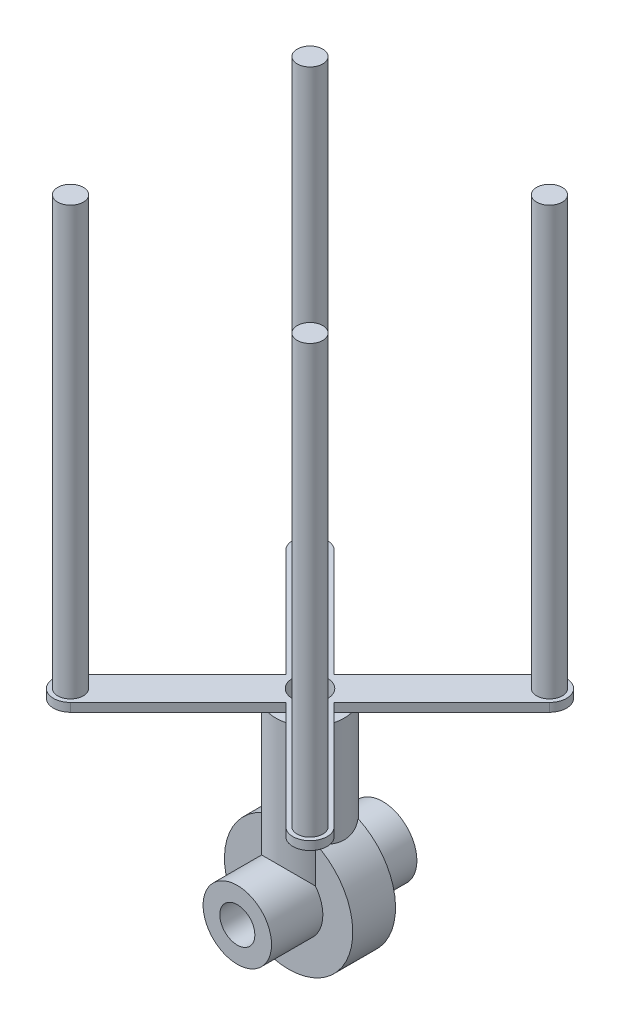
from build123d import *
from build123d.topology import SkipClean

# Parameters (mm, degrees)
SKETCH1_R           = 7.5000000000000115
SKETCH1_R_2         = 2.0499999999999923
BOSS_EXTRUDE1_DEPTH = 2.5
SKETCH2_R           = 4.000000000000007
SKETCH2_R_2         = 2.0499999999999923
BOSS_EXTRUDE2_DEPTH = 6
SKETCH7_W           = 4
SKETCH7_H           = 18.68716473083859
REVOLVE7_ANGLE      = 180.0000000000004
SKETCH8_W           = 2.049999999999997
SKETCH8_H           = 18.68716473083859
SKETCH9_R           = 2.0499999999999923
CUT_EXTRUDE1_DEPTH  = 5
BOSS_EXTRUDE3_START = 1
SKETCH10_R          = 2.049999999999978
BOSS_EXTRUDE3_DEPTH = 1
SKETCH11_R          = 1.4999999999999973
SKETCH11_R_2        = 1.4999999999999951
SKETCH11_R_3        = 1.4999999999999936
BOSS_EXTRUDE4_DEPTH = 50


with BuildPart() as part:
    # Sketch1 → Boss-Extrude1 (new body)
    with BuildSketch(Plane.XY):
        with Locations((102.34120530056146, 36.41611338878192)):
            Circle(SKETCH1_R)
        with Locations((102.34120530056146, 36.41611338878192)):
            Circle(SKETCH1_R_2, mode=Mode.SUBTRACT)
    boss_extrude1 = extrude(amount=BOSS_EXTRUDE1_DEPTH)

    # Sketch2 → Boss-Extrude2 (add)
    with BuildSketch(Plane.XY.offset(2.5)):
        with Locations((102.34120530056146, 36.41611338878192)):
            Circle(SKETCH2_R)
        with Locations((102.34120530056146, 36.41611338878192)):
            Circle(SKETCH2_R_2, mode=Mode.SUBTRACT)
    boss_extrude2 = extrude(amount=BOSS_EXTRUDE2_DEPTH)

    # Sketch7 → Revolve7 (revolve)
    with BuildSketch(Plane(origin=(0, 0, 0), x_dir=(-1, 0, 0), z_dir=(0, 0, -1))):
        with Locations((-104.34120530056146, 45.75969575420122)):
            Rectangle(SKETCH7_W, SKETCH7_H)
    revolve7 = revolve(axis=Axis((102.34120530056146, 36.41611338878192, 0), (0, -1, 0)), revolution_arc=REVOLVE7_ANGLE)

    # Sketch8 → Cut-Revolve2 (revolve, cut)
    with BuildSketch(Plane(origin=(0, 0, 0), x_dir=(-1, 0, 0), z_dir=(0, 0, -1))):
        with Locations((-103.36620530056146, 45.75969575420122)):
            Rectangle(SKETCH8_W, SKETCH8_H)
    cut_revolve2 = revolve(axis=Axis((102.34120530056146, 36.41611338878192, 0), (0, 1, 0)), mode=Mode.SUBTRACT)

    # Sketch9 → Cut-Extrude1 (cut)
    with BuildSketch(Plane(origin=(0, 0, 0), x_dir=(-1, 0, 0), z_dir=(0, 0, -1))):
        with Locations((-102.34120530056146, 36.41611338878192)):
            Circle(SKETCH9_R)
    cut_extrude1 = extrude(amount=-CUT_EXTRUDE1_DEPTH, mode=Mode.SUBTRACT)

    # Mirror1: Boss-Extrude1, Boss-Extrude2, Revolve7, Cut-Revolve2, Cut-Extrude1 across plane
    with SkipClean():  # the faces are left unmerged after this step: merging them gives an invalid solid
        add(boss_extrude1.mirror(Plane(origin=(102.34120530056146, 36.41611338878192, 0), x_dir=(1, 0, 0), z_dir=(0, 0, 1))))
        add(boss_extrude2.mirror(Plane(origin=(102.34120530056146, 36.41611338878192, 0), x_dir=(1, 0, 0), z_dir=(0, 0, 1))))
        add(revolve7.mirror(Plane(origin=(102.34120530056146, 36.41611338878192, 0), x_dir=(1, 0, 0), z_dir=(0, 0, 1))))
        add(cut_revolve2.mirror(Plane(origin=(102.34120530056146, 36.41611338878192, 0), x_dir=(1, 0, 0), z_dir=(0, 0, 1))), mode=Mode.SUBTRACT)
        add(cut_extrude1.mirror(Plane(origin=(102.34120530056146, 36.41611338878192, 0), x_dir=(1, 0, 0), z_dir=(0, 0, 1))), mode=Mode.SUBTRACT)

    # Sketch10 → Boss-Extrude3 (add)
    with BuildSketch(Plane(origin=(0, 55.103278119620505, 0), x_dir=(1, 0, 0), z_dir=(0, 1, 0)).offset(BOSS_EXTRUDE3_START)):
        with BuildLine():
            Line((102.34120530056146, 2.8284271247461854), (89.75541886293455, 15.4142135623731))
            ThreePointArc((89.75541886293455, 15.4142135623731), (86.92699173818836, 15.414213562373098), (86.92699173818835, 12.585786437626904))
            Line((86.92699173818835, 12.585786437626904), (99.51277817581526, 1.453e-14))
            Line((99.51277817581526, 1.453e-14), (86.92699173818836, -12.585786437626886))
            ThreePointArc((86.92699173818836, -12.585786437626886), (86.92699173818838, -15.414213562373114), (89.75541886293458, -15.41421356237309))
            Line((89.75541886293458, -15.41421356237309), (102.34120530056148, -2.8284271247462023))
            Line((102.34120530056148, -2.8284271247462023), (114.92699173818836, -15.414213562373098))
            ThreePointArc((114.92699173818836, -15.414213562373098), (117.75541886293455, -15.414213562373096), (117.75541886293456, -12.5857864376269))
            Line((117.75541886293456, -12.5857864376269), (105.16963242530763, 1.767e-14))
            Line((105.16963242530763, 1.767e-14), (117.75541886293452, 12.585786437626926))
            ThreePointArc((117.75541886293452, 12.585786437626926), (117.75541886293452, 15.414213562373076), (114.92699173818835, 15.414213562373087))
            Line((114.92699173818835, 15.414213562373087), (102.34120530056146, 2.8284271247461854))
        make_face()
        with Locations((102.34120530056148, 0)):
            Circle(SKETCH10_R, mode=Mode.SUBTRACT)
    extrude(amount=-BOSS_EXTRUDE3_DEPTH)

    # Sketch11 → Boss-Extrude4 (add)
    with BuildSketch(Plane(origin=(0, 56.103278119620505, 0), x_dir=(1, 0, 0), z_dir=(0, 1, 0))):
        with Locations((88.34120530056146, 14.000000000000002)):
            Circle(SKETCH11_R)
        with Locations((116.34120530056154, 14.000000000000359)):
            Circle(SKETCH11_R)
        with Locations((116.3412053005618, -13.999999999999707)):
            Circle(SKETCH11_R_2)
        with Locations((88.34120530056171, -13.99999999999986)):
            Circle(SKETCH11_R_3)
    extrude(amount=BOSS_EXTRUDE4_DEPTH)


solid = part.part
